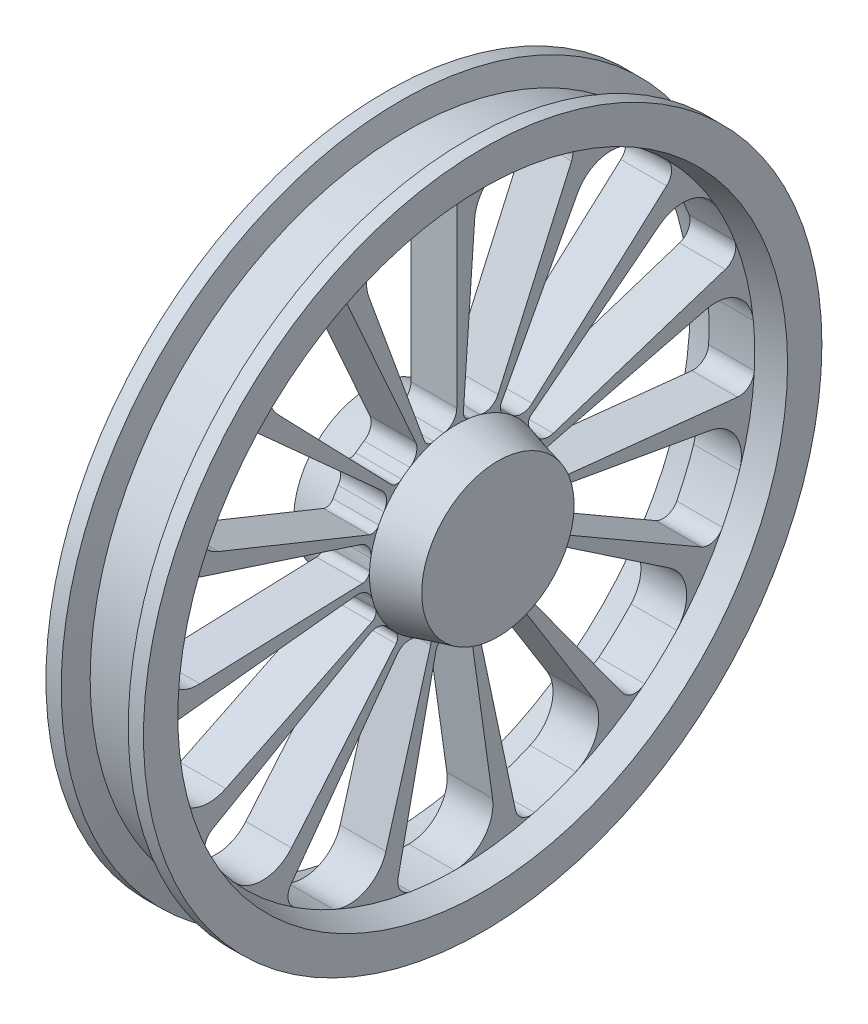
from build123d import *

# Parameters (mm, degrees)
CUT_EXTRUDE1_DEPTH = 652.3631859416066
FILLET1_R          = 50
FILLET2_R          = 20
FILLET3_R          = 10
CIRPATTERN1_START  = -30
CIRPATTERN1_DEPTH  = 60


# Read off the part's stored shape, not the designer's step: CirPattern1
with BuildPart() as part:
    # Sketch1 → Revolve1 (revolve)
    with BuildSketch(Plane(origin=(0, 0, 0), x_dir=(1, 0, 0), z_dir=(0, 1, 0))):
        Polygon((84, 3.9e-15), (84.00000000000001, 100), (30, 114.46925639128027), (30, 390.88972745734185), (64, 400), (64, 445), (44, 444.99999999999994), (35.961524227066555, 415.00000000000006), (0, 415.00000000000006), (0, 0), align=None)
    revolve1 = revolve(axis=Axis((90.85378995739825, 0, 0), (-1, 0, 1.6e-16)))

    # Mirror1: Revolve1 across plane
    add(revolve1.mirror(Plane(origin=(0, 0, 0), x_dir=(0, 0, 1), z_dir=(1, 0, 0))))

    # Sketch2 → Cut-Extrude1 (cut, through all)
    with BuildSketch(Plane.ZY.offset(84.00000000000003)):
        with BuildLine():
            Line((1.471e-14, 114.46925639128028), (1.471e-14, 390.8897274573418))
            ThreePointArc((1.471e-14, 390.8897274573418), (67.87728884169066, 384.9512341728192), (133.6921606094919, 367.31619243267886))
            Line((133.6921606094919, 367.31619243267886), (39.15079147732848, 107.56591553773623))
            ThreePointArc((39.15079147732848, 107.56591553773623), (19.87737777123451, 112.73021117567508), (1.471e-14, 114.46925639128028))
        make_face()
    extrude(amount=-CUT_EXTRUDE1_DEPTH, mode=Mode.SUBTRACT)

    # Fillet1
    fillet1_edges = [part.edges().sort_by_distance(p)[0] for p in [
        (0, 367.3161924326788, 133.6921606094919),
    ]]
    fillet(fillet1_edges, radius=FILLET1_R)

    # Fillet2
    fillet2_edges = [part.edges().sort_by_distance(p)[0] for p in [
        (0, 114.46925639128028, 1.579e-14),
        (0, 390.8897274573418, 1.471e-14),
    ]]
    fillet(fillet2_edges, radius=FILLET2_R)

    # Fillet3
    fillet3_edges = [part.edges().sort_by_distance(p)[0] for p in [
        (0, 107.56591553773623, 39.15079147732848),
    ]]
    fillet(fillet3_edges, radius=FILLET3_R)

    # CirPattern1 outline → CirPattern1 (cut)
    with BuildSketch(Plane.YZ.offset(CIRPATTERN1_START)):
        with BuildLine():
            ThreePointArc((89.246259396, 86.184110893), (86.209466021, 79.567065276), (88.464601936, 72.644510206))
            ThreePointArc((88.464601936, 72.644510206), (92.639664012, 67.239150132), (96.484917354, 61.594410314))
            ThreePointArc((96.484917354, 61.594410314), (107.587721386, 53.202032555), (121.477437258, 54.085239685))
            Line((121.477437258, 54.085239685), (338.331643407, 150.634952792))
            ThreePointArc((338.331643407, 150.634952792), (349.055044184, 162.244721227), (348.00257547, 178.014006466))
            ThreePointArc((348.00257547, 178.014006466), (333.898386748, 203.240365968), (317.968844827, 227.35565256))
            ThreePointArc((317.968844827, 227.35565256), (281.84292411, 248.066699649), (242.563477978, 234.240827861))
            Line((242.563477978, 234.240827861), (89.246259396, 86.184110893))
        make_face()
        with BuildLine():
            ThreePointArc((76.383210968, -97.766051719), (70.119845565, -94.054224606), (62.999487084, -95.573402607))
            ThreePointArc((62.999487084, -95.573402607), (57.187325315, -99.160579275), (51.17156955, -102.394731938))
            ThreePointArc((51.17156955, -102.394731938), (41.664607071, -112.559471297), (41.091105245, -126.465418136))
            Line((41.091105245, -126.465418136), (114.444472, -352.223867394))
            ThreePointArc((114.444472, -352.223867394), (124.869740304, -364.102075513), (140.662652686, -364.703711485))
            ThreePointArc((140.662652686, -364.703711485), (167.225108724, -353.313659578), (192.87337979, -339.992115203))
            ThreePointArc((192.87337979, -339.992115203), (217.247156573, -306.228989985), (207.602844499, -265.719523637))
            Line((207.602844499, -265.719523637), (76.383210968, -97.766051719))
        make_face()
        with BuildLine():
            ThreePointArc((109.544571103, -58.245881643), (102.312965989, -57.402499062), (96.426100203, -61.686447931))
            ThreePointArc((96.426100203, -61.686447931), (92.575462416, -67.327516048), (88.39524446, -72.728889828))
            ThreePointArc((88.39524446, -72.728889828), (83.844574036, -85.881671302), (88.976712183, -98.818650079))
            Line((88.976712183, -98.818650079), (247.812580983, -275.223753772))
            ThreePointArc((247.812580983, -275.223753772), (262.167839983, -281.83469821), (276.840090748, -275.960763853))
            ThreePointArc((276.840090748, -275.960763853), (296.473350327, -254.75150947), (314.485851617, -232.149581444))
            ThreePointArc((314.485851617, -232.149581444), (323.019704472, -191.391723617), (297.73250263, -158.30717976))
            Line((297.73250263, -158.30717976), (109.544571103, -58.245881643))
        make_face()
        with BuildLine():
            ThreePointArc((-21.543991171, -122.182045453), (-22.976575549, -115.043760736), (-28.869994608, -110.768831673))
            ThreePointArc((-28.869994608, -110.768831673), (-35.424881715, -108.849843428), (-41.853651834, -106.543336192))
            ThreePointArc((-41.853651834, -106.543336192), (-55.76892486, -106.279824431), (-66.486804921, -115.158524156))
            Line((-66.486804921, -115.158524156), (-185.17504552, -320.732587135))
            ThreePointArc((-185.17504552, -320.732587135), (-187.026408318, -336.428143931), (-176.905989939, -348.567138089))
            ThreePointArc((-176.905989939, -348.567138089), (-150.667779487, -360.685457506), (-123.605899547, -370.831984366))
            ThreePointArc((-123.605899547, -370.831984366), (-82.205767711, -366.35329001), (-58.554671797, -332.080045617))
            Line((-58.554671797, -332.080045617), (-21.543991171, -122.182045453))
        make_face()
        with BuildLine():
            ThreePointArc((30.014499737, -120.381583276), (25.802366823, -114.443120259), (18.679690316, -112.934847715))
            ThreePointArc((18.679690316, -112.934847715), (11.910980137, -113.847877499), (5.099865386, -114.355594668))
            ThreePointArc((5.099865386, -114.355594668), (-7.719548967, -119.774716133), (-13.899527092, -132.245166494))
            Line((-13.899527092, -132.245166494), (-38.712125887, -368.321274491))
            ThreePointArc((-38.712125887, -368.321274491), (-34.019471879, -383.412896196), (-19.836635906, -390.386074172))
            ThreePointArc((-19.836635906, -390.386074172), (9.062126628, -390.78466819), (37.911348397, -389.046923512))
            ThreePointArc((37.911348397, -389.046923512), (73.910601674, -368.116481981), (81.576768543, -327.18654789))
            Line((81.576768543, -327.18654789), (30.014499737, -120.381583276))
        make_face()
        with BuildLine():
            ThreePointArc((123.764679713, -8.654469484), (116.815245111, -10.825359946), (113.179764594, -17.133346004))
            ThreePointArc((113.179764594, -17.133346004), (111.956461043, -23.852913646), (110.334578557, -30.487561947))
            ThreePointArc((110.334578557, -30.487561947), (111.527052446, -44.35415013), (121.477437258, -54.085239685))
            Line((121.477437258, -54.085239685), (338.331643407, -150.634952792))
            ThreePointArc((338.331643407, -150.634952792), (354.134738409, -150.835541199), (365.149362106, -139.501693126))
            ThreePointArc((365.149362106, -139.501693126), (374.458656284, -112.14050903), (381.720862685, -84.16627604))
            ThreePointArc((381.720862685, -84.16627604), (372.939210926, -43.461089497), (336.381506241, -23.522086328))
            Line((336.381506241, -23.522086328), (123.764679713, -8.654469484))
        make_face()
        with BuildLine():
            ThreePointArc((-54.387349428, 111.510591465), (-49.032585837, 106.577649788), (-41.751969406, 106.583224334))
            ThreePointArc((-41.751969406, 106.583224334), (-35.32100135, 108.883596204), (-28.764286133, 110.796328919))
            ThreePointArc((-28.764286133, 110.796328919), (-17.351705447, 118.762335692), (-13.899527092, 132.245166494))
            Line((-13.899527092, 132.245166494), (-38.712125887, 368.321274491))
            ThreePointArc((-38.712125887, 368.321274491), (-46.439958732, 382.107450424), (-61.762670935, 385.979470323))
            ThreePointArc((-61.762670935, 385.979470323), (-90.112798528, 380.360963524), (-117.97029815, 372.66310226))
            ThreePointArc((-117.97029815, 372.66310226), (-148.831197883, 344.705375477), (-147.82002881, 303.075972932))
            Line((-147.82002881, 303.075972932), (-54.387349428, 111.510591465))
        make_face()
        with BuildLine():
            ThreePointArc((-95.040759663, 79.74866638), (-88.14253157, 77.420178486), (-81.493624872, 80.386564574))
            ThreePointArc((-81.493624872, 80.386564574), (-76.554288749, 85.103769205), (-71.342409829, 89.517993826))
            ThreePointArc((-71.342409829, 89.517993826), (-64.156565437, 101.437217886), (-66.486804921, 115.158524156))
            Line((-66.486804921, 115.158524156), (-185.17504552, 320.732587135))
            ThreePointArc((-185.17504552, 320.732587135), (-197.842115033, 330.183692747), (-213.41500154, 327.488650413))
            ThreePointArc((-213.41500154, 327.488650413), (-237.028879232, 310.824853321), (-259.346969223, 292.461841248))
            ThreePointArc((-259.346969223, 292.461841248), (-276.168372053, 254.36892818), (-258.312419695, 216.749856095))
            Line((-258.312419695, 216.749856095), (-95.040759663, 79.74866638))
        make_face()
        with BuildLine():
            ThreePointArc((46.476278932, 115.032826981), (46.393425059, 107.752679872), (51.269251042, 102.345857544))
            ThreePointArc((51.269251042, 102.345857544), (57.281918048, 99.105966135), (63.090654297, 95.513245151))
            ThreePointArc((63.090654297, 95.513245151), (76.647058044, 92.362343811), (88.976712183, 98.818650079))
            Line((88.976712183, 98.818650079), (247.812580983, 275.223753772))
            ThreePointArc((247.812580983, 275.223753772), (252.886776813, 290.191405024), (245.511352658, 304.169286332))
            ThreePointArc((245.511352658, 304.169286332), (222.366050337, 321.478022094), (198.005118957, 337.029304213))
            ThreePointArc((198.005118957, 337.029304213), (156.578506416, 341.256051484), (126.318435501, 312.649099053))
            Line((126.318435501, 312.649099053), (46.476278932, 115.032826981))
        make_face()
        with BuildLine():
            ThreePointArc((-4.329872383, 123.991322244), (-1.444460566, 117.306877215), (5.208980876, 114.350676329))
            ThreePointArc((5.208980876, 114.350676329), (12.019608063, 113.836460244), (18.78744395, 112.91697219))
            ThreePointArc((18.78744395, 112.91697219), (32.45342205, 115.552366736), (41.091105245, 126.465418136))
            Line((41.091105245, 126.465418136), (114.444472, 352.223867394))
            ThreePointArc((114.444472, 352.223867394), (112.992088327, 367.961358586), (100.568986571, 377.7309333))
            ThreePointArc((100.568986571, 377.7309333), (72.38460369, 384.129207664), (43.8045092, 388.427527353))
            ThreePointArc((43.8045092, 388.427527353), (4.240242491, 375.439131804), (-11.768212041, 336.99750069))
            Line((-11.768212041, 336.99750069), (-4.329872383, 123.991322244))
        make_face()
        with BuildLine():
            ThreePointArc((-105.21469872, -65.745440601), (-100.868505424, -59.904378152), (-101.635081079, -52.664228398))
            ThreePointArc((-101.635081079, -52.664228398), (-104.59507048, -46.508944195), (-107.18268841, -40.188082362))
            ThreePointArc((-107.18268841, -40.188082362), (-116.297996086, -29.670695434), (-130.067817428, -27.646768056))
            Line((-130.067817428, -27.646768056), (-362.257052982, -77.000113623))
            ThreePointArc((-362.257052982, -77.000113623), (-375.15992831, -86.126660375), (-377.409077319, -101.770169447))
            ThreePointArc((-377.409077319, -101.770169447), (-368.857954017, -129.377698193), (-358.290360817, -156.277945909))
            ThreePointArc((-358.290360817, -156.277945909), (-327.259946962, -184.047408187), (-285.964290589, -178.69032093))
            Line((-285.964290589, -178.69032093), (-105.21469872, -65.745440601))
        make_face()
        with BuildLine():
            ThreePointArc((-69.377330286, -102.856121981), (-67.782659274, -95.752289842), (-71.427795188, -89.449878331))
            ThreePointArc((-71.427795188, -89.449878331), (-76.635459693, -85.030682558), (-81.570292424, -80.308766973))
            ThreePointArc((-81.570292424, -80.308766973), (-94.175346999, -74.408185563), (-107.577910166, -78.159926809))
            Line((-107.577910166, -78.159926809), (-299.61951752, -217.686321699))
            ThreePointArc((-299.61951752, -217.686321699), (-307.694779676, -231.271909226), (-303.386691171, -246.477777197))
            ThreePointArc((-303.386691171, -246.477777197), (-284.345857756, -268.220454494), (-263.750564535, -288.49682622))
            ThreePointArc((-263.750564535, -288.49682622), (-224.108013043, -301.244285981), (-188.561477431, -279.553886604))
            Line((-188.561477431, -279.553886604), (-69.377330286, -102.856121981))
        make_face()
        with BuildLine():
            ThreePointArc((-119.260759134, 34.197472384), (-112.011832845, 34.876054983), (-107.144292252, 40.290337509))
            ThreePointArc((-107.144292252, 40.290337509), (-104.550644149, 46.608727367), (-101.58478274, 52.761184354))
            ThreePointArc((-101.58478274, 52.761184354), (-99.868172419, 66.572683578), (-107.577910166, 78.159926809))
            Line((-107.577910166, 78.159926809), (-299.61951752, 217.686321699))
            ThreePointArc((-299.61951752, 217.686321699), (-315.035572305, 221.168174969), (-328.165939564, 212.372067706))
            ThreePointArc((-328.165939564, 212.372067706), (-342.960513377, 187.544302223), (-355.880193224, 161.691270953))
            ThreePointArc((-355.880193224, 161.691270953), (-355.753525784, 120.049782332), (-324.14024652, 92.945720028))
            Line((-324.14024652, 92.945720028), (-119.260759134, 34.197472384))
        make_face()
        with BuildLine():
            ThreePointArc((-122.859489901, -17.266775262), (-116.513270624, -13.698455266), (-114.268738126, -6.772454937))
            ThreePointArc((-114.268738126, -6.772454937), (-114.469243363, 0.05461314), (-114.262223847, 6.881486787))
            ThreePointArc((-114.262223847, 6.881486787), (-118.311665116, 20.197127486), (-130.067817428, 27.646768056))
            Line((-130.067817428, 27.646768056), (-362.257052982, 77.000113623))
            ThreePointArc((-362.257052982, 77.000113623), (-377.756517117, 73.910670489), (-386.174005344, 60.534425153))
            ThreePointArc((-386.174005344, 60.534425153), (-389.59115906, 31.835637484), (-390.878498747, 2.96281099))
            ThreePointArc((-390.878498747, 2.96281099), (-373.825662988, -35.027061499), (-333.921280001, -46.929575416))
            Line((-333.921280001, -46.929575416), (-122.859489901, -17.266775262))
        make_face()
    extrude(amount=CIRPATTERN1_DEPTH, mode=Mode.SUBTRACT)


solid = part.part
